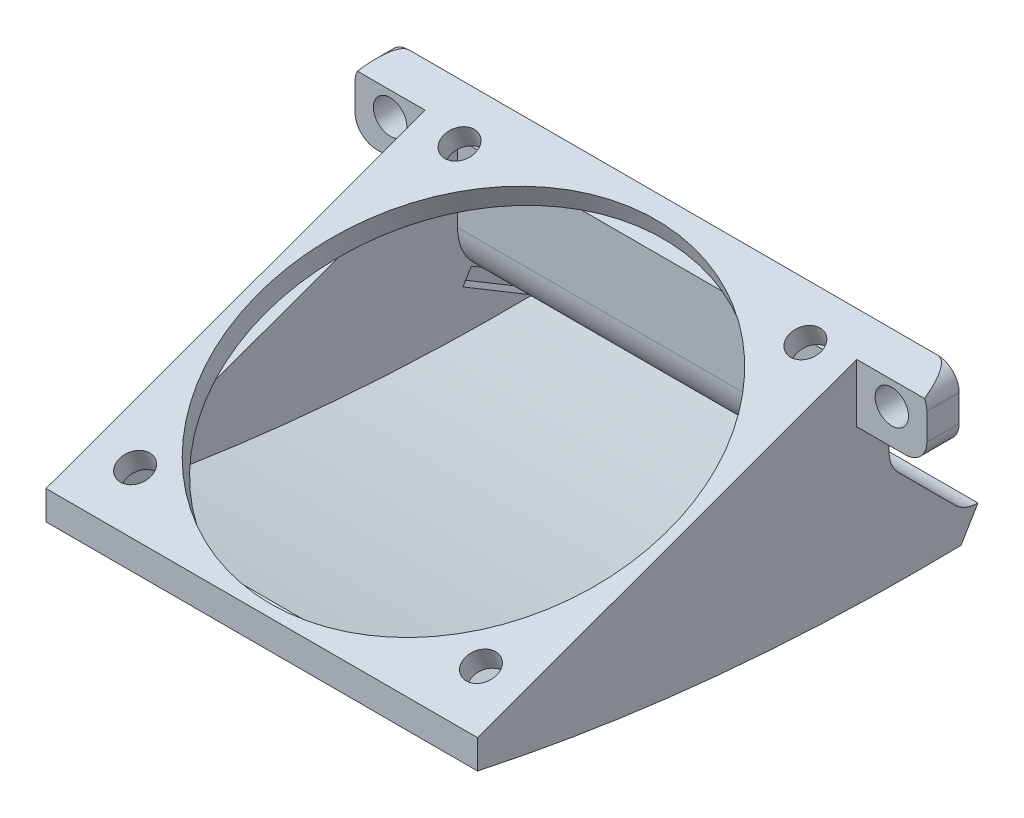
from build123d import *

# Parameters (mm, degrees)
Y_KSEKLIK_EKSTR_ZYON1_DEPTH = 40
BO_ALTMA1_START             = 2
BO_ALTMA1_DEPTH             = 36
IZIM4_W                     = 38.8
IZIM4_H                     = 1.5
KES_EKSTR_ZYON1_DEPTH       = 10
IZIM5_R                     = 1.45
IZIM5_R_2                   = 19
KES_EKSTR_ZYON2_DEPTH       = 2
IZIM6_W                     = 6.5
IZIM6_H                     = 6.5
IZIM6_R                     = 1.55
Y_KSEKLIK_EKSTR_ZYON2_DEPTH = 3
RADYUS1_R                   = 2
KES_EKSTR_ZYON3_DEPTH       = 10
KES_EKSTR_ZYON3_DEPTH_BACK  = 55


# Read off the part's stored shape, not the designer's step: İç Boşaltma1
with BuildPart() as part:
    # Çizim2 → Yükseklik-Ekstrüzyon1 (new body)
    with BuildSketch(Plane(origin=(0, 0, 0), x_dir=(0, 0, -1), z_dir=(1, 0, 0))):
        with BuildLine():
            Line((-8.520601237, 2.655177464), (-8.520601237, -7.344822536))
            ThreePointArc((-8.520601237, -7.344822536), (-8.2732007, -8.537800405), (-7.571803773, -9.53401603))
            Line((-7.571803773, -9.53401603), (-2.399280893, -14.708783566))
            ThreePointArc((-2.399280893, -14.708783566), (-1.426311448, -15.35897725), (-0.27796055, -15.587463223))
            Line((-0.27796055, -15.587463223), (-1.843021011, -18.19863418))
            add(Edge.make_bspline(
                [(-46.665907249, -13.909076506), (-24.516902354, -18.673937552), (-1.843021011, -18.19863418)],
                knots=[0, 0, 0, 1, 1, 1], degree=2))
            Line((-46.665907249, -13.909076506), (-46.665907249, -11.228578501))
            Line((-46.665907249, -11.228578501), (-8.520601237, 2.655177464))
        make_face()
    extrude(amount=Y_KSEKLIK_EKSTR_ZYON1_DEPTH)

    # İç Boşaltma1 outline → İç Boşaltma1 (cut)
    with BuildSketch(Plane.YZ.offset(BO_ALTMA1_START)):
        with BuildLine():
            Line((-0.201118549, 10.520601237), (-12.409947295, 44.064082645))
            add(Edge.make_bspline(
                [(-12.409947295, 44.064082645), (-12.786167702, 42.211926114), (-13.142061282, 40.357797151), (-13.477631026, 38.501688751), (-13.792879631, 36.643593797), (-14.087809503, 34.783505061), (-14.362422751, 32.921415207), (-14.616721192, 31.057316786), (-14.850706351, 29.19120224), (-15.064379456, 27.323063899), (-15.257741445, 25.452893983), (-15.526587368, 22.544304232), (-15.616158228, 21.507298941), (-15.699505521, 20.469667421), (-15.77662923, 19.431408364), (-15.847529338, 18.39252046), (-15.912205827, 17.353002403), (-15.970658681, 16.312852883), (-16.02288788, 15.272070593), (-16.06889341, 14.230654225), (-16.108675251, 13.18860247), (-16.159012454, 11.624569796), (-16.174235562, 11.103066399), (-16.187902686, 10.581403672), (-16.200013803, 10.059581454), (-16.210568888, 9.537599587), (-16.219567918, 9.01545791), (-16.227010868, 8.493156266), (-16.232897715, 7.970694494), (-16.237228434, 7.448072435), (-16.240003003, 6.92528993), (-16.241792402, 6.157267265), (-16.242021612, 5.912152435), (-16.241909023, 5.667002314), (-16.241454632, 5.421816888), (-16.240658436, 5.176596139), (-16.23952043, 4.931340051), (-16.238040611, 4.68604861), (-16.236218976, 4.440721798), (-16.234055521, 4.1953596), (-16.231550242, 3.949961999), (-16.228703137, 3.704528981)],
                knots=[0.04971795, 0.04971795, 0.04971795, 0.04971795, 0.04971795, 0.04971795, 0.04971795, 0.04971795, 0.04971795, 0.04971795, 0.04971795, 0.04971795, 0.513850496, 0.513850496, 0.513850496, 0.513850496, 0.513850496, 0.513850496, 0.513850496, 0.513850496, 0.513850496, 0.513850496, 0.770775744, 0.770775744, 0.770775744, 0.770775744, 0.770775744, 0.770775744, 0.770775744, 0.770775744, 0.770775744, 0.770775744, 0.899238368, 0.899238368, 0.899238368, 0.899238368, 0.899238368, 0.899238368, 0.899238368, 0.899238368, 0.899238368, 0.899238368, 0.959442934, 0.959442934, 0.959442934, 0.959442934, 0.959442934, 0.959442934, 0.959442934, 0.959442934, 0.959442934, 0.959442934, 0.959442934, 0.959442934], degree=11))
            ThreePointArc((-16.228703137, 3.704528981), (-16.17611264, 3.759568607), (-16.122690278, 3.81380118))
            Line((-16.122690278, 3.81380118), (-10.968143105, 8.966112527))
            ThreePointArc((-10.968143105, 8.966112527), (-9.316172777, 10.115574384), (-7.344822536, 10.520601237))
            Line((-7.344822536, 10.520601237), (-0.201118549, 10.520601237))
        make_face()
    extrude(amount=BO_ALTMA1_DEPTH, mode=Mode.SUBTRACT)

    # Çizim4 → Kes-Ekstrüzyon1 (cut)
    with BuildSketch(Plane(origin=(0, -3.997164066, -6.668930038), x_dir=(-1, 0, 0), z_dir=(0, -0.5140990756107078, -0.8577308088533464))):
        with Locations((-20, -15.0127467)):
            Rectangle(IZIM4_W, IZIM4_H)
    extrude(amount=-KES_EKSTR_ZYON1_DEPTH, mode=Mode.SUBTRACT)

    # Çizim5 → Kes-Ekstrüzyon2 (cut)
    with BuildSketch(Plane(origin=(0, 5.083049154, 1.850078591), x_dir=(1, 0, 0), z_dir=(0, 0.9396926207859106, 0.34202014332566266))):
        with Locations(Location((4, -11.159288927, 0), (0, 0, 270))):
            Circle(IZIM5_R)
        with Locations(Location((35.999942492, -11.09862193, 0), (0, 0, 270))):
            Circle(IZIM5_R)
        with Locations(Location((4, -43.159288927, 0), (0, 0, 270))):
            Circle(IZIM5_R)
        with Locations(Location((35.999942492, -43.09862193, 0), (0, 0, 270))):
            Circle(IZIM5_R)
        with Locations(Location((20, -27.798590964, 0), (0, 0, 270))):
            Circle(IZIM5_R_2)
    extrude(amount=-KES_EKSTR_ZYON2_DEPTH, mode=Mode.SUBTRACT)

    # Çizim6 → Yükseklik-Ekstrüzyon2 (add)
    # profile 1 of 2: a face of its own
    with BuildSketch(Plane(origin=(0, 0, 8.520601237), x_dir=(-1, 0, 0), z_dir=(0, 0, -1))):
        with Locations((-43.25, -0.594822536)):
            Rectangle(IZIM6_W, IZIM6_H)
        with Locations(Location((-43.25, -0.594822536, 0), (0, 0, 90))):
            Circle(IZIM6_R, mode=Mode.SUBTRACT)
    # profile 2 of 2: a face of its own
    with BuildSketch(Plane(origin=(0, 0, 8.520601237), x_dir=(-1, 0, 0), z_dir=(0, 0, -1))):
        with Locations((3.25, -0.594822536)):
            Rectangle(IZIM6_W, IZIM6_H)
        with Locations(Location((3.25, -0.594822536, 0), (0, 0, 90))):
            Circle(IZIM6_R, mode=Mode.SUBTRACT)
    extrude(amount=-Y_KSEKLIK_EKSTR_ZYON2_DEPTH)

    # Radyus1
    radyus1_edges = [part.edges().sort_by_distance(p)[0] for p in [
        (-6.5, -3.844822536, 10.020601237),
        (-6.5, 2.655177464, 10.020601237),
        (46.5, -3.844822536, 10.020601237),
        (46.5, 2.655177464, 10.020601237),
    ]]
    fillet(radyus1_edges, radius=RADYUS1_R)

    # Çizim7 → Kes-Ekstrüzyon3 (cut, two sides: drawn at the far end of the back side and taken through both)
    with BuildSketch(Plane.ZY.offset(-KES_EKSTR_ZYON3_DEPTH_BACK)):
        Polygon((11.520601237, 1.563266761), (8.520601237, 2.655177464), (11.520601237, 2.655177464), align=None)
    extrude(amount=KES_EKSTR_ZYON3_DEPTH + KES_EKSTR_ZYON3_DEPTH_BACK, mode=Mode.SUBTRACT)


solid = part.part
